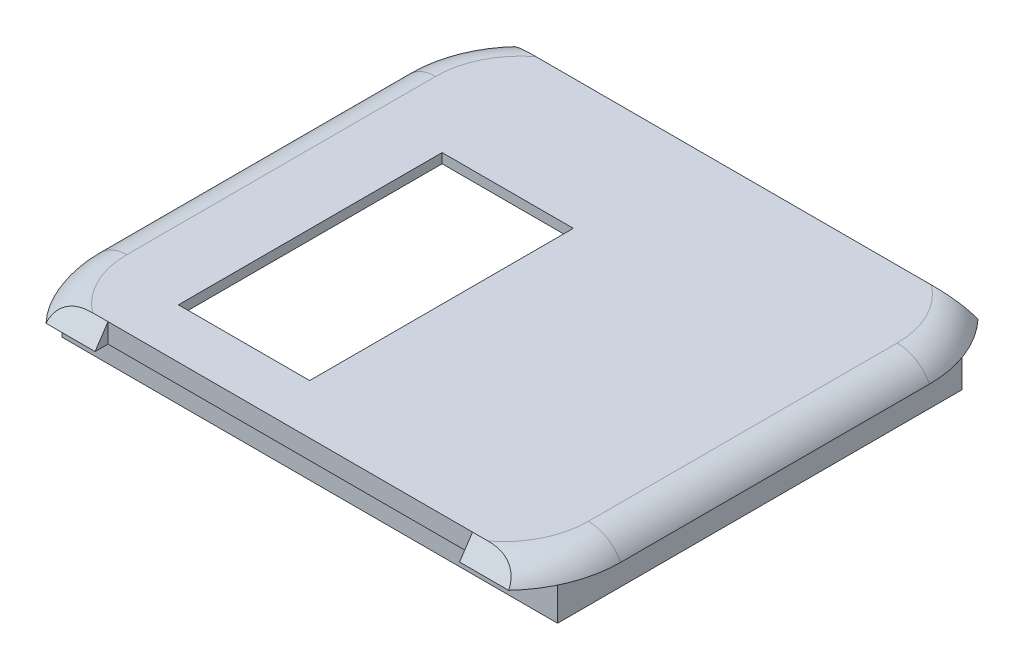
from build123d import *

# Parameters (mm, degrees)
SKETCH_1_W          = 40.8
SKETCH_1_H          = 33.3
EXTRUDE_3_DEPTH     = 16.4
SKETCH_2_W          = 40.8
SKETCH_2_H          = 33.3
EXTRUDE_4_DEPTH     = 1.6
SKETCH_4_W          = 17.099999999999994
SKETCH_4_H          = 13.8
CUT_EXTRUDE_1_DEPTH = 0.8
SKETCH_5_W          = 4.100000000000001
SKETCH_5_H          = 6.399999999999999
CUT_EXTRUDE_2_DEPTH = 0.8
EXTRUDE_5_DEPTH     = 3.5
EXTRUDE_5_2_DEPTH   = 3.5
EXTRUDE_5_3_DEPTH   = 3.5
SKETCH_6_W          = 3.000000000000007
SKETCH_6_H          = 3.0000000000000036
EXTRUDE_5_4_DEPTH   = 3.5
SKETCH_7_W          = 3.000000000000007
SKETCH_7_H          = 33.3
EXTRUDE_7_DEPTH     = 1.6
SKETCH_8_R          = 2.4500000000000015
SKETCH_8_W          = 10.999999999999998
SKETCH_8_H          = 4.8999999999999995
CUT_EXTRUDE_3_DEPTH = 1.6
SKETCH_10_W         = 44
SKETCH_10_H         = 36.49999999999999
EXTRUDE_8_DEPTH     = 1.6
SKETCH_11_W         = 2.0999999999999996
SKETCH_11_H         = 6.020000000000001
EXTRUDE_9_DEPTH     = 44
EXTRUDE_12_DEPTH    = 7
SKETCH_15_W         = 2.1000000000000085
SKETCH_15_H         = 6.019999999999997
EXTRUDE_13_DEPTH    = 37
EXTRUDE_14_DEPTH    = 7
EXTRUDE_15_DEPTH    = 7
FILLET_1_R          = 10
FILLET_2_R          = 3.2
FILLET_3_R          = 3
SKETCH_17_W         = 56.29646115275759
SKETCH_17_H         = 50.293284015615065
CUT_EXTRUDE_4_DEPTH = 16.4
EXTRUDE_16_DEPTH    = 3
CUT_EXTRUDE_6_DEPTH = 0.8
CUT_EXTRUDE_7_DEPTH = 0.8
CUT_EXTRUDE_8_DEPTH = 0.8


with BuildPart() as part:
    # Эскиз1 → Бобышка-Вытянуть3 (new body)
    with BuildSketch(Plane(origin=(0, 0, 0), x_dir=(1, 0, 0), z_dir=(0, 1, 0))):
        Polygon((42.399999999999984, 34.89999999999999), (42.39999999999999, -1.600000000000004), (-1.6000000000000032, -1.600000000000004), (-1.6000000000000076, 34.89999999999999), align=None)
        with Locations((20.4, 16.65)):
            Rectangle(SKETCH_1_W, SKETCH_1_H, mode=Mode.SUBTRACT)
    extrude(amount=EXTRUDE_3_DEPTH)

    # Эскиз2 → Бобышка-Вытянуть4 (add)
    with BuildSketch(Plane(origin=(0, 0, 0), x_dir=(-1, 0, 0), z_dir=(0, -1, 0))):
        with Locations((-20.4, 16.65)):
            Rectangle(SKETCH_2_W, SKETCH_2_H)
    extrude(amount=-EXTRUDE_4_DEPTH)

    # Эскиз4 → Вырез-Вытянуть1 (cut)
    with BuildSketch(Plane(origin=(0, 1.6, 0), x_dir=(1, 0, 0), z_dir=(0, 1, 0))):
        with Locations((20.4, 16.65)):
            Rectangle(SKETCH_4_W, SKETCH_4_H)
    extrude(amount=-CUT_EXTRUDE_1_DEPTH, mode=Mode.SUBTRACT)

    # Эскиз5 → Вырез-Вытянуть2 (cut)
    with BuildSketch(Plane(origin=(0, 0.8, 0), x_dir=(1, 0, 0), z_dir=(0, 1, 0))):
        with Locations((20.4, 16.65)):
            Rectangle(SKETCH_5_W, SKETCH_5_H)
    extrude(amount=-CUT_EXTRUDE_2_DEPTH, mode=Mode.SUBTRACT)

    # Эскиз8 → Вырез-Вытянуть3 (cut)
    with BuildSketch(Plane.ZY.offset(1.6000000000000034)):
        with Locations((-22.149999999999995, 8.95)):
            Circle(SKETCH_8_R)
        with Locations((-11.149999999999993, 8.95)):
            Circle(SKETCH_8_R)
        with Locations((-16.64999999999999, 8.950000000000001)):
            Rectangle(SKETCH_8_W, SKETCH_8_H)
    extrude(amount=-CUT_EXTRUDE_3_DEPTH, mode=Mode.SUBTRACT)

    # Эскиз10 → Бобышка-Вытянуть8 (add)
    with BuildSketch(Plane(origin=(0, 16.4, 0), x_dir=(1, 0, 0), z_dir=(0, 1, 0))):
        with Locations((20.39999999999999, 16.649999999999995)):
            Rectangle(SKETCH_10_W, SKETCH_10_H)
    extrude(amount=EXTRUDE_8_DEPTH)



with BuildPart() as body_2:
    # Эскиз6 → Бобышка-Вытянуть5 (new body)
    with BuildSketch(Plane(origin=(0, 1.6, 0), x_dir=(1, 0, 0), z_dir=(0, 1, 0))):
        Polygon((0, 33.3), (3, 33.3), (3.0000000000000004, 30.299999999999997), (3.7e-16, 30.299999999999997), align=None)
    extrude(amount=EXTRUDE_5_DEPTH)


with BuildPart() as body_3:
    # Эскиз6 → Extrude 5 2 (new body)
    with BuildSketch(Plane(origin=(0, 1.6, 0), x_dir=(1, 0, 0), z_dir=(0, 1, 0))):
        Polygon((0, 0), (3, 0), (2.9999999999999996, 3), (-8.7e-16, 3), align=None)
    extrude(amount=EXTRUDE_5_2_DEPTH)


with BuildPart() as body_4:
    # Эскиз6 → Extrude 5 3 (new body)
    with BuildSketch(Plane(origin=(0, 1.6, 0), x_dir=(1, 0, 0), z_dir=(0, 1, 0))):
        Polygon((40.8, 0), (37.79999999999999, -3.7e-16), (37.79999999999999, 2.9999999999999996), (40.8, 3), align=None)
    extrude(amount=EXTRUDE_5_3_DEPTH)


with BuildPart() as body_5:
    # Эскиз6 → Extrude 5 4 (new body)
    with BuildSketch(Plane(origin=(0, 1.6, 0), x_dir=(1, 0, 0), z_dir=(0, 1, 0))):
        with Locations((39.3, 31.799999999999997)):
            Rectangle(SKETCH_6_W, SKETCH_6_H)
    extrude(amount=EXTRUDE_5_4_DEPTH)


with BuildPart() as body_6:
    # Эскиз7 → Бобышка-Вытянуть7 (new body)
    with BuildSketch(Plane(origin=(0, 5.1000000000000005, 0), x_dir=(1, 0, 0), z_dir=(0, 1, 0))):
        with Locations((39.3, 16.65)):
            Rectangle(SKETCH_7_W, SKETCH_7_H)
    extrude(amount=EXTRUDE_7_DEPTH)


with BuildPart() as body_6_1:
    # Move Body 1: read off the stored shape, not the designer's step
    # Move Body 1: moved
    add(body_6.part.moved(Location((0, 5.27, 0))))


with BuildPart() as body_7:
    # Эскиз11 → Бобышка-Вытянуть9 (new body)
    with BuildSketch(Plane(origin=(42.39999999999999, 0, -8.06e-15), x_dir=(-1.9e-16, 0, -1), z_dir=(1, 0, -1.9e-16))):
        with Locations((-5.008433364905541, 9)):
            Rectangle(SKETCH_11_W, SKETCH_11_H)
    extrude(amount=-EXTRUDE_9_DEPTH)


with BuildPart() as part_1:
    add(part.part)

    add(body_7.part)  # Бобышка-Вытянуть12 merges body 7
    # Эскиз12 → Бобышка-Вытянуть12 (add)
    with BuildSketch(Plane(origin=(42.39999999999999, 0, -8.06e-15), x_dir=(-1.9e-16, 0, -1), z_dir=(1, 0, -1.9e-16))):
        Polygon((-1.6000000000000123, 0), (-6.0584333649055395, 6.675491735766058), (-6.05843336490554, 11.309768082903124), (-1.6000000000000123, 18), align=None)
        Polygon((34.899999999999984, 18.00000000000004), (34.899999999999984, 3.25e-15), (39.35843336490551, 6.675491735766043), (39.35843336490551, 11.309768082903172), align=None)
    extrude(amount=-EXTRUDE_12_DEPTH)

    # Эскиз15 → Бобышка-Вытянуть13 (add)
    with BuildSketch(Plane.ZY.offset(-35.39999999999997)):
        with Locations((-38.30843336490551, 8.994768082903173)):
            Rectangle(SKETCH_15_W, SKETCH_15_H)
    extrude(amount=EXTRUDE_13_DEPTH)

    # Эскиз16 → Бобышка-Вытянуть14 (add)
    with BuildSketch(Plane.ZY.offset(1.6000000000000034)):
        Polygon((-34.89999999999999, 18), (-39.358433364905515, 11.309768082903172), (-39.358433364905515, 6.6797680829031725), (-34.89999999999999, 0), align=None)
    extrude(amount=-EXTRUDE_14_DEPTH)

    # Эскиз14 → Бобышка-Вытянуть15 (add)
    with BuildSketch(Plane.ZY.offset(1.6000000000000034)):
        Polygon((1.600000000000004, 18), (6.058433364905541, 11.309768082903124), (6.05843336490554, 6.675491735766058), (1.600000000000004, 0), align=None)
    extrude(amount=-EXTRUDE_15_DEPTH)

    # Скругление1
    # the kernel refuses this fillet: 10 mm, written as the material it takes off along each edge
    with BuildSketch(Plane(origin=(-1.6000000000000074, 37.010000000000005, 6.05843336490554), x_dir=(4.2e-16, 0, -1), z_dir=(0, -1, 0))) as fillet_1_piece_1:
        with BuildLine():
            CenterArc((FILLET_1_R, FILLET_1_R), FILLET_1_R, 180, 89.99999999999994)
            Line((6.88e-15, FILLET_1_R), (0, 0))
            Line((0, 0), (FILLET_1_R, 0))
        make_face()
    extrude(amount=56.02000000000001, mode=Mode.SUBTRACT)
    with BuildSketch(Plane(origin=(42.39999999999999, 37.01, 6.058433364905532), x_dir=(0, 0, -1), z_dir=(0, -1, 0))) as fillet_1_piece_2:
        with BuildLine():
            CenterArc((FILLET_1_R, -FILLET_1_R), FILLET_1_R, 89.99999999999999, 90.00000000000001)
            Line((-5.33e-15, -FILLET_1_R), (0, 0))
            Line((0, 0), (FILLET_1_R, 0))
        make_face()
    extrude(amount=56.019999999999996, mode=Mode.SUBTRACT)
    with BuildSketch(Plane(origin=(42.399999999999984, -18.324508264233955, -39.358433364905515), x_dir=(0, 0, 1), z_dir=(0, 1, 0))) as fillet_1_piece_3:
        with BuildLine():
            CenterArc((FILLET_1_R, -FILLET_1_R), FILLET_1_R, 90.00000000000003, 89.99999999999997)
            Line((7.11e-15, -FILLET_1_R), (0, 0))
            Line((0, 0), (FILLET_1_R, 0))
        make_face()
    extrude(amount=54.634276347137124, mode=Mode.SUBTRACT)
    with BuildSketch(Plane(origin=(-1.6000000000000298, -19.015231917096827, -39.358433364905515), x_dir=(1, 0, 7.1e-16), z_dir=(0, 1, 0))) as fillet_1_piece_4:
        with BuildLine():
            CenterArc((FILLET_1_R, -FILLET_1_R), FILLET_1_R, 90.00000000000006, 89.99999999999994)
            Line((8.88e-15, -FILLET_1_R), (0, 0))
            Line((0, 0), (FILLET_1_R, 0))
        make_face()
    extrude(amount=56.02, mode=Mode.SUBTRACT)

    # Скругление2
    # the kernel refuses this fillet: 3.2 mm, written as the material it takes off along each edge
    with BuildSketch(Plane(origin=(35.39999999999997, 5.984768082903174, -37.25843336490551), x_dir=(0, 4.2e-16, -1), z_dir=(-1, 0, 0))) as fillet_2_piece_1:
        with BuildLine():
            CenterArc((3.200000000000004, -3.0049958402633457), FILLET_2_R, 110.10550978791592, 69.89449021208412)
            Line((1.27e-15, -3.004995840263347), (0, 0))
            Line((0, 0), (2.1000000000000085, 0))
        make_face()
    extrude(amount=29.99999999999998, mode=Mode.SUBTRACT)
    with BuildSketch(Plane(origin=(35.39999999999997, 5.984768082903174, -37.25843336490551), x_dir=(0, 4.2e-16, -1), z_dir=(-1, 0, 0))) as fillet_2_piece_2_section:
        with BuildLine():
            CenterArc((3.200000000000004, -3.0049958402633457), FILLET_2_R, 110.10550978791592, 69.89449021208412)
            Line((1.27e-15, -3.004995840263347), (0, 0))
            Line((0, 0), (2.1000000000000085, 0))
        make_face()
    fillet_2_piece_2 = extrude(amount=37.51248960065835, mode=Mode.PRIVATE)
    fillet_2_piece_2 = split(fillet_2_piece_2, bisect_by=Plane(origin=(35.39999999999997, 5.229293666046891, -38.39030940389469), z_dir=(0, -0.5551530875809806, -0.8317481886660796)), keep=Keep.TOP, mode=Mode.PRIVATE)
    add(fillet_2_piece_2, mode=Mode.SUBTRACT)
    with BuildSketch(Plane(origin=(35.39999999999997, 12.004768082903173, -37.25843336490551), x_dir=(0, -8.5e-16, -1), z_dir=(-1, 0, 0))) as fillet_2_piece_3:
        with BuildLine():
            CenterArc((3.2000000000000055, 3.004995840263345), FILLET_2_R, 179.99999999999994, 69.89449021208412)
            Line((2.54e-15, 3.004995840263348), (0, 0))
            Line((0, 0), (2.1000000000000085, 0))
        make_face()
    extrude(amount=29.99999999999998, mode=Mode.SUBTRACT)
    with BuildSketch(Plane(origin=(42.91248960065834, 12.004768082903173, -37.25843336490551), x_dir=(0, -8.5e-16, -1), z_dir=(-1, 0, 0))) as fillet_2_piece_4_section:
        with BuildLine():
            CenterArc((3.2000000000000055, 3.004995840263345), FILLET_2_R, 179.99999999999994, 69.89449021208412)
            Line((2.54e-15, 3.004995840263348), (0, 0))
            Line((0, 0), (2.1000000000000085, 0))
        make_face()
    fillet_2_piece_4 = extrude(amount=45.02497920131672, mode=Mode.PRIVATE)
    fillet_2_piece_4 = split(fillet_2_piece_4, bisect_by=Plane(origin=(42.91248960065834, 12.760123030249147, -38.39190321044578), z_dir=(0, 0.5545519689982268, -0.8321490934202775)), keep=Keep.TOP, mode=Mode.PRIVATE)
    add(fillet_2_piece_4, mode=Mode.SUBTRACT)
    with BuildSketch(Plane(origin=(35.39999999999999, 5.99, 3.958433364905534), x_dir=(1.9e-16, 0, 1), z_dir=(-1, 0, 1.9e-16))) as fillet_2_piece_5:
        with BuildLine():
            CenterArc((3.2000000000000006, 3.0049958402633443), FILLET_2_R, 180, 69.89449021208401)
            Line((4.4e-16, 3.0049958402633443), (0, 0))
            Line((0, 0), (2.1, 0))
        make_face()
    extrude(amount=29.999999999999993, mode=Mode.SUBTRACT)
    with BuildSketch(Plane(origin=(42.91248960065835, 12.01, 3.9584333649055328), x_dir=(1.9e-16, 8.5e-16, 1), z_dir=(-1, 0, 1.9e-16))) as fillet_2_piece_6_section:
        with BuildLine():
            CenterArc((3.1999999999999984, -3.004995840263345), FILLET_2_R, 110.10550978791599, 69.89449021208395)
            Line((-2.1e-15, -3.0049958402633425), (0, 0))
            Line((0, 0), (2.0999999999999996, 0))
        make_face()
    fillet_2_piece_6 = extrude(amount=45.024979201316704, mode=Mode.PRIVATE)
    fillet_2_piece_6 = split(fillet_2_piece_6, bisect_by=Plane(origin=(42.91248960065835, 12.763745986939767, 5.089488838090781), z_dir=(0, 0.5545519689982267, 0.8321490934202775)), keep=Keep.TOP, mode=Mode.PRIVATE)
    add(fillet_2_piece_6, mode=Mode.SUBTRACT)
    with BuildSketch(Plane(origin=(35.39999999999999, 12.01, 3.958433364905534), x_dir=(1.9e-16, 8.5e-16, 1), z_dir=(-1, 0, 1.9e-16))) as fillet_2_piece_7:
        with BuildLine():
            CenterArc((3.199999999999998, -3.004995840263345), FILLET_2_R, 110.10550978791599, 69.89449021208395)
            Line((-2.1e-15, -3.0049958402633425), (0, 0))
            Line((0, 0), (2.099999999999999, 0))
        make_face()
    extrude(amount=29.999999999999993, mode=Mode.SUBTRACT)

    # Скругление3
    fillet_3_edges = [part_1.edges().sort_by_distance(p)[0] for p in [
        (41.97186604889837, 17.999999999999996, -32.25314929949211),
        (41.97186604889837, 0, -32.25314929949211),
        (41.97186604889836, 0, -1.0468507005078767),
        (41.97186604889836, 18, -1.0468507005078767),
        (42.39999999999999, 18, -16.65),
        (42.399999999999984, 0, -16.65),
        (-1.6000000000000076, 18, -16.65),
        (-1.6000000000000054, 0, -16.65),
        (-1.1718660488983677, 0, -32.25314929949211),
        (-1.1718660488983677, 17.999999999999996, -32.25314929949211),
        (-1.171866048898364, 0, -1.0468507005078784),
        (-1.171866048898364, 18, -1.0468507005078784),
    ]]
    fillet(fillet_3_edges, radius=FILLET_3_R)


with BuildPart() as cut_extrude_4_tool:
    # Эскиз17 → Вырез-Вытянуть4 (new body)
    with BuildSketch(Plane.XZ):
        with Locations((20.4, -16.650000000000002)):
            Rectangle(SKETCH_17_W, SKETCH_17_H)
    extrude(amount=-CUT_EXTRUDE_4_DEPTH)


with BuildPart() as part_2:
    add(part_1.part)

    # Вырез-Вытянуть4: cut by cut_extrude_4_tool
    add(cut_extrude_4_tool.part, mode=Mode.SUBTRACT)

    # Эскиз18 → Бобышка-Вытянуть16 (add)
    with BuildSketch(Plane(origin=(0, 16.4, 0), x_dir=(-1, 0, 0), z_dir=(0, -1, 0))):
        Polygon((-40.79999999999996, 9.16e-15), (3.296e-14, 1.166e-14), (3.123e-14, 33.30000000000001), (-40.79999999999996, 33.30000000000001), align=None)
        Polygon((-39.999999999999964, 0.8000000000000085), (-0.7999999999999708, 0.8000000000000107), (-0.7999999999999735, 32.500000000000014), (-39.999999999999964, 32.500000000000014), align=None, mode=Mode.SUBTRACT)
    extrude(amount=EXTRUDE_16_DEPTH)

    # Эскиз21 → Вырез-Вытянуть6 (cut)
    with BuildSketch(Plane.XZ.offset(-16.4)):
        Polygon((5.64771181596363, -0.8000000000000085), (19.34771181596362, -0.800000000000006), (19.34771181596363, -32.500000000000014), (5.647711815963632, -32.500000000000014), align=None)
    extrude(amount=-CUT_EXTRUDE_6_DEPTH, mode=Mode.SUBTRACT)

    # Эскиз22 → Вырез-Вытянуть7 (cut)
    with BuildSketch(Plane.XZ.offset(-16.4)):
        Polygon((23.499999999999968, -9.125000000000016), (35.49999999999997, -9.125000000000016), (35.49999999999997, -24.125000000000014), (23.499999999999968, -24.125000000000018), align=None)
    extrude(amount=-CUT_EXTRUDE_7_DEPTH, mode=Mode.SUBTRACT)

    # Эскиз23 → Вырез-Вытянуть8 (cut)
    with BuildSketch(Plane.XZ.offset(-17.199999999999996)):
        Polygon((7.0977118159636365, -2.5000000000000115), (17.89771181596363, -2.5000000000000093), (17.897711815963632, -24.200000000000014), (7.097711815963637, -24.200000000000014), align=None)
    extrude(amount=-CUT_EXTRUDE_8_DEPTH, mode=Mode.SUBTRACT)


with BuildPart() as body_2_1:
    add(body_2.part)

    # Вырез-Вытянуть4: cut by cut_extrude_4_tool
    add(cut_extrude_4_tool.part, mode=Mode.SUBTRACT)


with BuildPart() as body_3_1:
    add(body_3.part)

    # Вырез-Вытянуть4: cut by cut_extrude_4_tool
    add(cut_extrude_4_tool.part, mode=Mode.SUBTRACT)


with BuildPart() as body_4_1:
    add(body_4.part)

    # Вырез-Вытянуть4: cut by cut_extrude_4_tool
    add(cut_extrude_4_tool.part, mode=Mode.SUBTRACT)


with BuildPart() as body_5_1:
    add(body_5.part)

    # Вырез-Вытянуть4: cut by cut_extrude_4_tool
    add(cut_extrude_4_tool.part, mode=Mode.SUBTRACT)


with BuildPart() as body_6_2:
    add(body_6_1.part)

    # Вырез-Вытянуть4: cut by cut_extrude_4_tool
    add(cut_extrude_4_tool.part, mode=Mode.SUBTRACT)


solid = part_2.part
